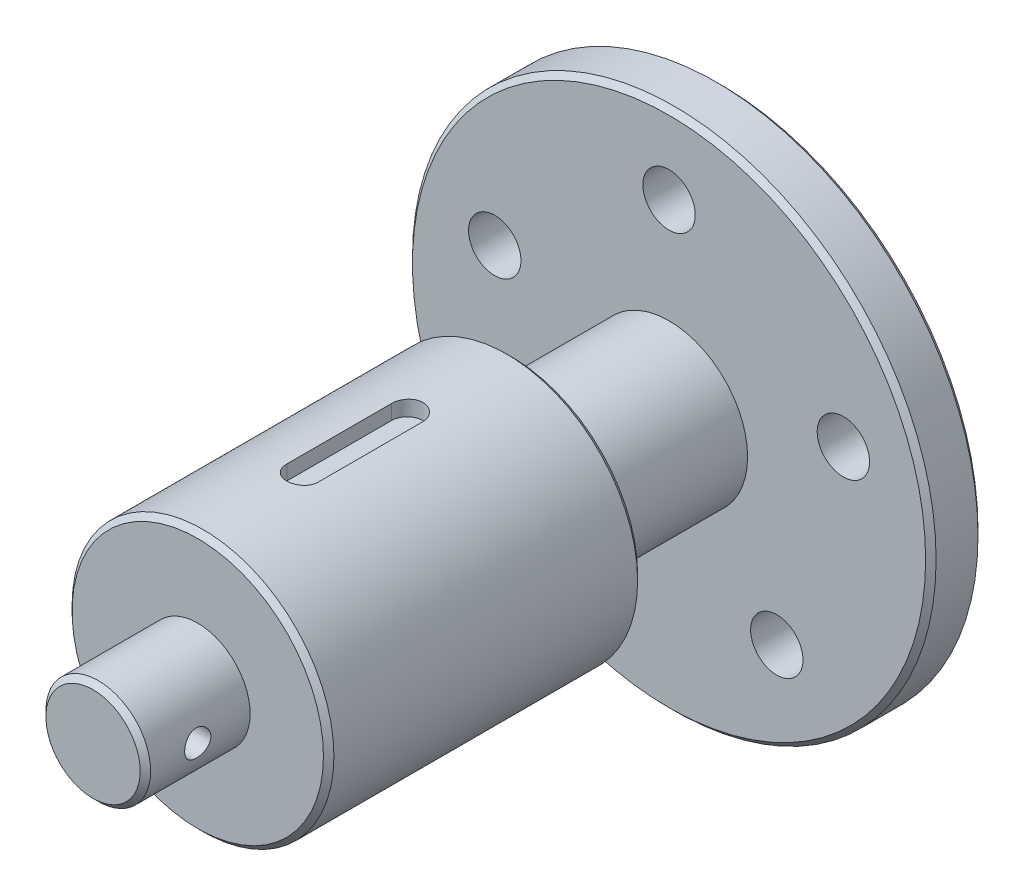
from build123d import *

# Parameters (mm, degrees)
SKETCH_1_R              = 50
EXTRUDE_1_DEPTH         = 10
SKETCH_2_R              = 15
EXTRUDE_2_DEPTH         = 28
SKETCH_3_R              = 16
EXTRUDE_3_DEPTH         = 2
SKETCH_4_R              = 25
EXTRUDE_4_DEPTH         = 60
SKETCH_5_R              = 10
EXTRUDE_5_DEPTH         = 20
CHAMFER_1_SIZE          = 1
HOLE_WIZARD_10_0_10_1_D = 10
CUT_EXTRUDE_1_DEPTH     = 3
HOLE_WIZARD_5_0_5_1_D   = 5


# Read off the part's stored shape, not the designer's step: 구배27
with BuildPart() as part:
    # 스케치1 → 보스-돌출1 (new body)
    with BuildSketch(Plane.XY):
        Circle(SKETCH_1_R)
    extrude(amount=EXTRUDE_1_DEPTH)

    # 스케치2 → 보스-돌출2 (add)
    with BuildSketch(Plane.XY.offset(10)):
        Circle(SKETCH_2_R)
    extrude(amount=EXTRUDE_2_DEPTH)

    # 스케치3 → 보스-돌출3 (add)
    with BuildSketch(Plane.XY.offset(38)):
        Circle(SKETCH_3_R)
    extrude(amount=EXTRUDE_3_DEPTH)

    # 스케치4 → 보스-돌출4 (add)
    with BuildSketch(Plane.XY.offset(40)):
        Circle(SKETCH_4_R)
    extrude(amount=EXTRUDE_4_DEPTH)

    # 스케치5 → 보스-돌출5 (add)
    with BuildSketch(Plane.XY.offset(100)):
        Circle(SKETCH_5_R)
    extrude(amount=EXTRUDE_5_DEPTH)

    # 모따기1
    chamfer_1_edges = [part.edges().sort_by_distance(p)[0] for p in [
        (-25, 0, 40),
        (-25, 0, 100),
        (-50, 0, 0),
        (-10, 0, 120),
        (-50, 0, 10),
    ]]
    chamfer(chamfer_1_edges, length=CHAMFER_1_SIZE)

    # 구배27 outline → 구배27 (revolve, cut)
    with BuildSketch(Plane.XZ):
        Polygon((16, 40), (15, 39), (15, 38), (16, 38), align=None)
    revolve(axis=Axis((0, 0, 0), (0, 0, 1)), mode=Mode.SUBTRACT)

    # Ø10.0 (10) 지름 구멍1 (through all)
    with Locations(Plane(origin=(0, 0, 0), x_dir=(-1, 0, 0), z_dir=(0, 0, -1))):
        with Locations((0, 35), (-33.28697807, 10.815594803), (-20.57248383, -28.315594803), (20.57248383, -28.315594803), (33.28697807, 10.815594803)):
            Hole(HOLE_WIZARD_10_0_10_1_D / 2)

    # 스케치17 → 컷-돌출1 (cut)
    with BuildSketch(Plane(origin=(0, 25, 0), x_dir=(1, 0, 0), z_dir=(0, 1, 0))):
        with BuildLine():
            Line((-3, -60), (-3, -80))
            ThreePointArc((-3, -80), (0, -83), (3, -80))
            Line((3, -80), (3, -60))
            ThreePointArc((3, -60), (0, -57), (-3, -60))
        make_face()
    extrude(amount=-CUT_EXTRUDE_1_DEPTH, mode=Mode.SUBTRACT)

    # Ø5.0 (5) 지름 구멍1 (through all)
    with Locations(Plane(origin=(-10, 0, 0), x_dir=(0, 0, -1), z_dir=(-1, 0, 0))):
        with Locations((-110, 0)):
            Hole(HOLE_WIZARD_5_0_5_1_D / 2)


solid = part.part
